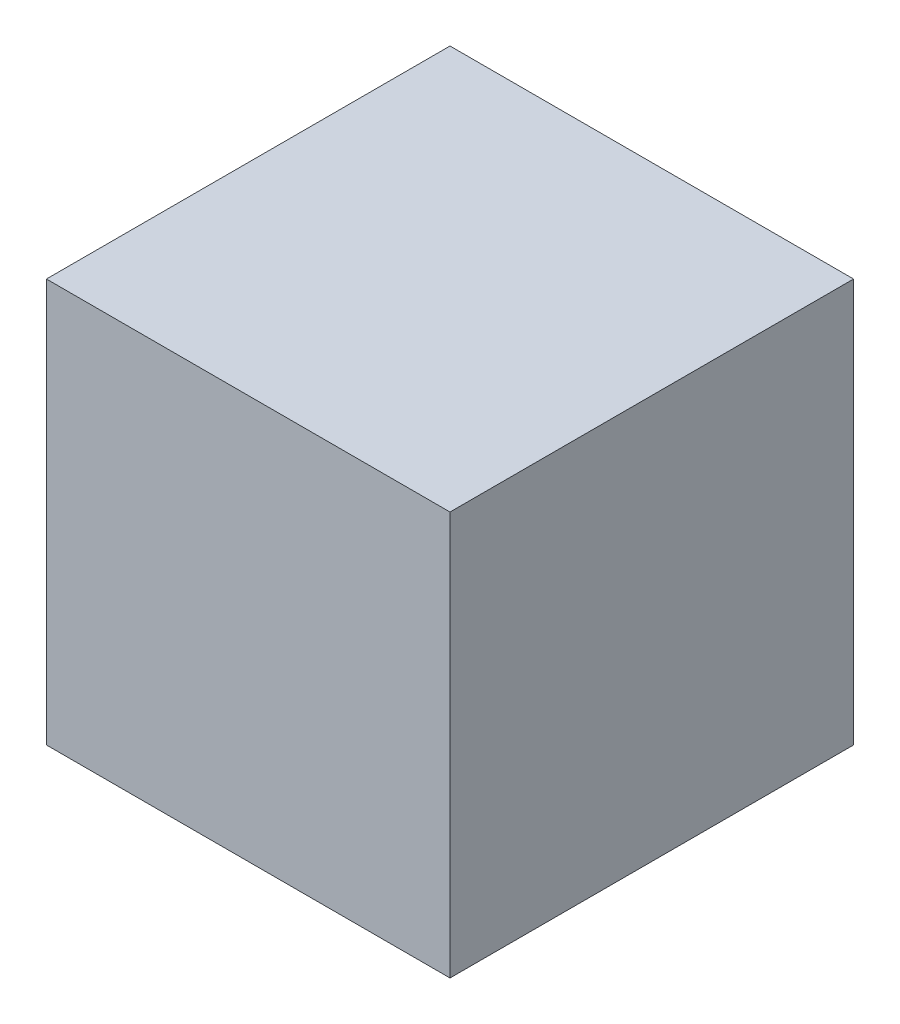
from build123d import *

# Parameters (mm, degrees)
BOSS_EXTRUDE1_DEPTH      = 60
BOSS_EXTRUDE1_DEPTH_BACK = 60
SKETCH1_W                = 120
SKETCH1_H                = 120


with BuildPart() as part:
    # Sketch1 → Boss-Extrude1 (new, two sides: drawn at the far end of the back side and taken through both)
    with BuildSketch(Plane.XY.offset(-BOSS_EXTRUDE1_DEPTH_BACK)):
        Rectangle(SKETCH1_W, SKETCH1_H)
    extrude(amount=BOSS_EXTRUDE1_DEPTH + BOSS_EXTRUDE1_DEPTH_BACK)


solid = part.part
